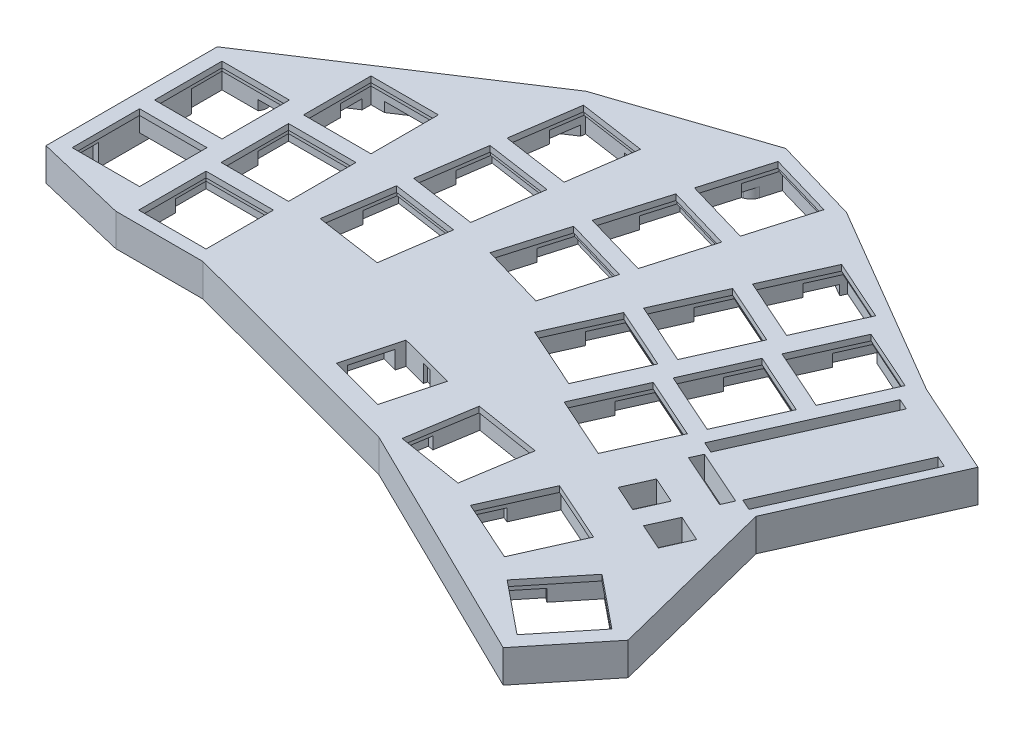
from build123d import *

# Parameters (mm, degrees)
LAYOUT_BASED_ON_OG_W   = 13.9
LAYOUT_BASED_ON_OG_H   = 13.9
TOP_PLATE_DEPTH        = 1.2
LAYOUT_BASED_ON_OG_7_R = 1
LAYOUT_BASED_ON_OG_7_W = 13.9
LAYOUT_BASED_ON_OG_7_H = 13.9
BOSS_EXTRUDE2_DEPTH    = 5.5
SKETCH1_W              = 14.7
SKETCH1_H              = 14.7
CUT_EXTRUDE1_DEPTH     = 5.5
CUT_EXTRUDE2_DEPTH     = 5.7
SKETCH5_W              = 17
SKETCH5_H              = 7.4
CUT_EXTRUDE3_DEPTH     = 4.5
CUT_EXTRUDE4_DEPTH     = 2.2
SKETCH8_R              = 2.5
SKETCH8_R_2            = 2.25
CUT_EXTRUDE5_DEPTH     = 2
FILLET1_R              = 0.75


with BuildPart() as part:
    # Layout Based on OG → Top Plate (new body)
    with BuildSketch(Plane(origin=(0, 0, 0), x_dir=(1, 0, 0), z_dir=(0, 1, 0))):
        Polygon((44.932112641, 64.586160661), (-1, 34.518088786), (-1, -0.789622065), (17.882445607, -5.291259199), (35.868672805, -5.291259199), (85.361540778, -18.518913408), (135.758281381, -43.294373445), (147.28611756, -29.083818781), (138.36478836, 6.221102631), (152.486966257, 37.866376671), (133.367786474, 46.398597243), (93.420652892, 69.813076074), (75.723768858, 74.969568789), align=None)
        with Locations((9, 8.5)):
            Rectangle(LAYOUT_BASED_ON_OG_W, LAYOUT_BASED_ON_OG_H, mode=Mode.SUBTRACT)
        with Locations((27, 4.208740801)):
            Rectangle(LAYOUT_BASED_ON_OG_W, LAYOUT_BASED_ON_OG_H, mode=Mode.SUBTRACT)
        Polygon((82.42671831, -1.483486994), (79.405763835, -12.786753516), (67.812669966, -9.68833867), (70.833624441, 1.614927852), align=None, mode=Mode.SUBTRACT)
        Polygon((124.073654328, -30.793104213), (132.830543438, -19.998341913), (143.625305738, -28.755231024), (134.868416628, -39.549993323), align=None, mode=Mode.SUBTRACT)
        Polygon((106.968309305, -21.25715678), (112.632924584, -8.563767408), (125.326313955, -14.228382687), (119.661698676, -26.921772059), align=None, mode=Mode.SUBTRACT)
        Polygon((87.98288219, -16.369909233), (90.169189468, -2.642926298), (103.896172402, -4.829233576), (101.709865125, -18.55621651), align=None, mode=Mode.SUBTRACT)
        Polygon((103.849381672, 19.547250989), (116.542771044, 13.88263571), (110.878155765, 1.189246339), (98.184766393, 6.853861618), align=None, mode=Mode.SUBTRACT)
        Polygon((124.470413663, -5.2830693), (118.991252783, -2.837911626), (121.436410458, 2.641249254), (126.915571338, 0.19609158), align=None, mode=Mode.SUBTRACT)
        Polygon((133.940230051, -9.509116814), (128.461069171, -7.06395914), (130.906226845, -1.58479826), (136.385387725, -4.029955934), align=None, mode=Mode.SUBTRACT)
        Polygon((132.512214648, 4.565915741), (120.951185191, 9.725198434), (121.970000889, 12.008182134), (133.531030346, 6.848899441), align=None, mode=Mode.SUBTRACT)
        with Locations((9, 25.5)):
            Rectangle(LAYOUT_BASED_ON_OG_W, LAYOUT_BASED_ON_OG_H, mode=Mode.SUBTRACT)
        with Locations((27, 21.208740801)):
            Rectangle(LAYOUT_BASED_ON_OG_W, LAYOUT_BASED_ON_OG_H, mode=Mode.SUBTRACT)
        with Locations((27, 38.208740801)):
            Rectangle(LAYOUT_BASED_ON_OG_W, LAYOUT_BASED_ON_OG_H, mode=Mode.SUBTRACT)
        Polygon((40.2890512, 14.443567583), (42.28500861, 28.199517351), (56.040958378, 26.20355994), (54.045000968, 12.447610172), align=None, mode=Mode.SUBTRACT)
        Polygon((63.880386081, 25.872461201), (67.768842672, 39.217494185), (81.113875656, 35.329037594), (77.225419065, 21.98400461), align=None, mode=Mode.SUBTRACT)
        Polygon((42.730150191, 31.26739104), (44.726107602, 45.023340808), (58.48205737, 43.027383397), (56.486099959, 29.271433629), align=None, mode=Mode.SUBTRACT)
        Polygon((45.171249182, 48.091214497), (47.167206593, 61.847164265), (60.923156361, 59.851206854), (58.92719895, 46.095257086), align=None, mode=Mode.SUBTRACT)
        Polygon((88.345576683, 28.974928579), (101.038966054, 23.310313301), (95.374350775, 10.616923929), (82.680961404, 16.281539208), align=None, mode=Mode.SUBTRACT)
        Polygon((95.273523427, 44.499217739), (107.966912798, 38.83460246), (102.302297519, 26.141213088), (89.608908148, 31.805828367), align=None, mode=Mode.SUBTRACT)
        Polygon((110.777328416, 35.071540149), (123.470717788, 29.40692487), (117.806102509, 16.713535498), (105.112713137, 22.378150777), align=None, mode=Mode.SUBTRACT)
        Polygon((122.242660591, 13.036314755), (119.959676891, 14.055130453), (132.389228402, 41.907531592), (134.672212102, 40.888715895), align=None, mode=Mode.SUBTRACT)
        Polygon((148.826711042, 34.572058569), (136.39715953, 6.71965743), (134.11417583, 7.738473128), (146.543727342, 35.590874267), align=None, mode=Mode.SUBTRACT)
        Polygon((112.040659882, 37.902439937), (117.70527516, 50.595829308), (130.398664532, 44.93121403), (124.734049253, 32.237824658), align=None, mode=Mode.SUBTRACT)
        Polygon((72.524509006, 55.538757546), (85.86954199, 51.650300955), (81.981085399, 38.305267971), (68.636052415, 42.193724562), align=None, mode=Mode.SUBTRACT)
        Polygon((96.536854892, 47.330117527), (102.201470171, 60.023506899), (114.894859542, 54.35889162), (109.230244263, 41.665502248), align=None, mode=Mode.SUBTRACT)
        Polygon((73.391718749, 58.514987924), (77.280175341, 71.860020908), (90.625208324, 67.971564317), (86.736751733, 54.626531333), align=None, mode=Mode.SUBTRACT)
    extrude(amount=TOP_PLATE_DEPTH)

    # Layout Based on OG<7> → Boss-Extrude2 (add)
    with BuildSketch(Plane(origin=(0, 0, 0), x_dir=(1, 0, 0), z_dir=(0, 1, 0))):
        Polygon((44.932112641, 64.586160661), (-1, 34.518088786), (-1, -0.789622065), (17.882445607, -5.291259199), (35.868672805, -5.291259199), (85.361540778, -18.518913408), (135.758281381, -43.294373445), (147.28611756, -29.083818781), (138.36478836, 6.221102631), (152.486966257, 37.866376671), (133.367786474, 46.398597243), (93.420652892, 69.813076074), (75.723768858, 74.969568789), align=None)
        with Locations((17.05, -2.008725367)):
            Circle(LAYOUT_BASED_ON_OG_7_R, mode=Mode.SUBTRACT)
        with Locations((9, 8.5)):
            Rectangle(LAYOUT_BASED_ON_OG_7_W, LAYOUT_BASED_ON_OG_7_H, mode=Mode.SUBTRACT)
        with Locations((27, 4.208740801)):
            Rectangle(LAYOUT_BASED_ON_OG_7_W, LAYOUT_BASED_ON_OG_7_H, mode=Mode.SUBTRACT)
        Polygon((82.42671831, -1.483486994), (79.405763835, -12.786753516), (67.812669966, -9.68833867), (70.833624441, 1.614927852), align=None, mode=Mode.SUBTRACT)
        with Locations((98.514300948, -21.642001273)):
            Circle(LAYOUT_BASED_ON_OG_7_R, mode=Mode.SUBTRACT)
        Polygon((124.073654328, -30.793104213), (132.830543438, -19.998341913), (143.625305738, -28.755231024), (134.868416628, -39.549993323), align=None, mode=Mode.SUBTRACT)
        Polygon((106.968309305, -21.25715678), (112.632924584, -8.563767408), (125.326313955, -14.228382687), (119.661698676, -26.921772059), align=None, mode=Mode.SUBTRACT)
        with Locations((143.005602273, -24.389532807)):
            Circle(LAYOUT_BASED_ON_OG_7_R, mode=Mode.SUBTRACT)
        Polygon((87.98288219, -16.369909233), (90.169189468, -2.642926298), (103.896172402, -4.829233576), (101.709865125, -18.55621651), align=None, mode=Mode.SUBTRACT)
        Polygon((103.849381672, 19.547250989), (116.542771044, 13.88263571), (110.878155765, 1.189246339), (98.184766393, 6.853861618), align=None, mode=Mode.SUBTRACT)
        Polygon((124.470413663, -5.2830693), (118.991252783, -2.837911626), (121.436410458, 2.641249254), (126.915571338, 0.19609158), align=None, mode=Mode.SUBTRACT)
        Polygon((133.940230051, -9.509116814), (128.461069171, -7.06395914), (130.906226845, -1.58479826), (136.385387725, -4.029955934), align=None, mode=Mode.SUBTRACT)
        Polygon((132.512214648, 4.565915741), (120.951185191, 9.725198434), (121.970000889, 12.008182134), (133.531030346, 6.848899441), align=None, mode=Mode.SUBTRACT)
        with Locations((9, 25.5)):
            Rectangle(LAYOUT_BASED_ON_OG_7_W, LAYOUT_BASED_ON_OG_7_H, mode=Mode.SUBTRACT)
        with Locations((27, 21.208740801)):
            Rectangle(LAYOUT_BASED_ON_OG_7_W, LAYOUT_BASED_ON_OG_7_H, mode=Mode.SUBTRACT)
        with Locations((5.901015243, 35.45)):
            Circle(LAYOUT_BASED_ON_OG_7_R, mode=Mode.SUBTRACT)
        with Locations((27, 38.208740801)):
            Rectangle(LAYOUT_BASED_ON_OG_7_W, LAYOUT_BASED_ON_OG_7_H, mode=Mode.SUBTRACT)
        Polygon((40.2890512, 14.443567583), (42.28500861, 28.199517351), (56.040958378, 26.20355994), (54.045000968, 12.447610172), align=None, mode=Mode.SUBTRACT)
        Polygon((63.880386081, 25.872461201), (67.768842672, 39.217494185), (81.113875656, 35.329037594), (77.225419065, 21.98400461), align=None, mode=Mode.SUBTRACT)
        Polygon((42.730150191, 31.26739104), (44.726107602, 45.023340808), (58.48205737, 43.027383397), (56.486099959, 29.271433629), align=None, mode=Mode.SUBTRACT)
        Polygon((45.171249182, 48.091214497), (47.167206593, 61.847164265), (60.923156361, 59.851206854), (58.92719895, 46.095257086), align=None, mode=Mode.SUBTRACT)
        with Locations((72.753454085, 70.801954714)):
            Circle(LAYOUT_BASED_ON_OG_7_R, mode=Mode.SUBTRACT)
        Polygon((88.345576683, 28.974928579), (101.038966054, 23.310313301), (95.374350775, 10.616923929), (82.680961404, 16.281539208), align=None, mode=Mode.SUBTRACT)
        Polygon((95.273523427, 44.499217739), (107.966912798, 38.83460246), (102.302297519, 26.141213088), (89.608908148, 31.805828367), align=None, mode=Mode.SUBTRACT)
        Polygon((110.777328416, 35.071540149), (123.470717788, 29.40692487), (117.806102509, 16.713535498), (105.112713137, 22.378150777), align=None, mode=Mode.SUBTRACT)
        Polygon((122.242660591, 13.036314755), (119.959676891, 14.055130453), (132.389228402, 41.907531592), (134.672212102, 40.888715895), align=None, mode=Mode.SUBTRACT)
        Polygon((148.826711042, 34.572058569), (136.39715953, 6.71965743), (134.11417583, 7.738473128), (146.543727342, 35.590874267), align=None, mode=Mode.SUBTRACT)
        Polygon((112.040659882, 37.902439937), (117.70527516, 50.595829308), (130.398664532, 44.93121403), (124.734049253, 32.237824658), align=None, mode=Mode.SUBTRACT)
        with Locations((145.3286298, 37.775717045)):
            Circle(LAYOUT_BASED_ON_OG_7_R, mode=Mode.SUBTRACT)
        Polygon((72.524509006, 55.538757546), (85.86954199, 51.650300955), (81.981085399, 38.305267971), (68.636052415, 42.193724562), align=None, mode=Mode.SUBTRACT)
        Polygon((96.536854892, 47.330117527), (102.201470171, 60.023506899), (114.894859542, 54.35889162), (109.230244263, 41.665502248), align=None, mode=Mode.SUBTRACT)
        Polygon((73.391718749, 58.514987924), (77.280175341, 71.860020908), (90.625208324, 67.971564317), (86.736751733, 54.626531333), align=None, mode=Mode.SUBTRACT)
    extrude(amount=-BOSS_EXTRUDE2_DEPTH)

    # Sketch1 → Cut-Extrude1 (cut)
    with BuildSketch(Plane.XZ):
        Polygon((124.936316134, -31.709536754), (130.926952436, -45.13348091), (117.50300828, -51.124117212), (111.512371978, -37.700173056), align=None)
        Polygon((118.00836939, -16.185247595), (123.999005692, -29.60919175), (110.575061536, -35.599828052), (104.584425234, -22.175883897), align=None)
        Polygon((111.080422646, -0.660958435), (117.071058948, -14.084902591), (103.647114792, -20.075538893), (97.65647849, -6.651594737), align=None)
        Polygon((95.576617656, -10.088636025), (101.567253958, -23.512580181), (88.143309802, -29.503216483), (82.1526735, -16.079272327), align=None)
        Polygon((102.5045644, -25.612925185), (108.495200702, -39.036869341), (95.071256546, -45.027505643), (89.080620244, -31.603561487), align=None)
        Polygon((109.432511144, -41.137214344), (115.423147446, -54.5611585), (101.99920329, -60.551794802), (96.008566988, -47.127850647), align=None)
        Polygon((119.863965557, 27.450059962), (125.854601859, 14.026115807), (112.430657703, 8.035479505), (106.440021401, 21.45942366), align=None)
        Polygon((144.187943189, 28.696587191), (134.927060461, 40.112630774), (123.511016877, 30.851748046), (132.771899605, 19.435704463), align=None)
        Polygon((104.354108811, 4.497127801), (102.041970899, 19.014152919), (87.524945781, 16.702015007), (89.837083693, 2.184989889), align=None)
        Polygon((86.365469748, -51.92243265), (82.253217094, -37.809340214), (68.140124658, -41.921592868), (72.252377311, -56.034685304), align=None)
        Polygon((91.121136082, -68.243696011), (87.008883428, -54.130603575), (72.895790992, -58.242856229), (77.008043646, -72.355948665), align=None)
        Polygon((61.376448654, -60.189623901), (59.265615997, -45.641964794), (44.71795689, -47.752797451), (46.828789547, -62.300456558), align=None)
        with Locations((27, -38.208740801)):
            Rectangle(SKETCH1_W, SKETCH1_H)
        Polygon((81.609803413, -35.601169288), (77.497550759, -21.488076852), (63.384458323, -25.600329506), (67.496710977, -39.713421942), align=None)
        Polygon((58.935349662, -43.365800443), (56.824517005, -28.818141336), (42.276857898, -30.928973994), (44.387690555, -45.476633101), align=None)
        Polygon((56.494250671, -26.541976986), (54.383418014, -11.994317879), (39.835758907, -14.105150536), (41.946591564, -28.652809644), align=None)
        with Locations((27, -21.208740801)):
            Rectangle(SKETCH1_W, SKETCH1_H)
        with Locations((27, -4.208740801)):
            Rectangle(SKETCH1_W, SKETCH1_H)
        with Locations((9, -8.5)):
            Rectangle(SKETCH1_W, SKETCH1_H)
        with Locations((9, -25.5)):
            Rectangle(SKETCH1_W, SKETCH1_H)
    extrude(amount=CUT_EXTRUDE1_DEPTH, mode=Mode.SUBTRACT)

    # Sketch4 → Cut-Extrude2 (cut)
    with BuildSketch(Plane.XZ.offset(5.5)):
        Polygon((75.052980345, 9.708478692), (74.381657128, 12.220315697), (72.449474817, 11.703913223), (73.120798034, 9.192076218), align=None)
        Polygon((83.02323238, 11.838638899), (75.052980345, 9.708478692), (77.118590243, 1.979749446), (85.088842277, 4.109909653), align=None)
        Polygon((77.789913459, -0.532087558), (77.118590243, 1.979749446), (75.186407931, 1.463346972), (75.857731148, -1.048490033), align=None)
        Polygon((75.186407931, 1.463346972), (73.120798034, 9.192076218), (65.150545999, 7.061916011), (67.216155897, -0.666813235), align=None)
    extrude(amount=-CUT_EXTRUDE2_DEPTH, mode=Mode.SUBTRACT)

    # Sketch5 → Cut-Extrude3 (cut)
    with BuildSketch(Plane.XZ.offset(5.5)):
        Polygon((90.476814804, -61.9215247), (92.546928385, -69.026074634), (76.225665023, -73.781740968), (74.155551443, -66.677191034), align=None)
        Polygon((80.965482135, -29.278997977), (83.035595716, -36.383547911), (66.714332355, -41.139214245), (64.644218774, -34.034664311), align=None)
        Polygon((85.72114847, -45.600261338), (87.79126205, -52.704811272), (71.469998689, -57.460477607), (69.399885108, -50.355927673), align=None)
        Polygon((113.926280704, -48.385044029), (116.941975169, -55.142675781), (101.417686009, -62.070622525), (98.401991544, -55.312990773), align=None)
        Polygon((106.99833396, -32.86075487), (110.014028425, -39.618386622), (94.489739265, -46.546333366), (91.4740448, -39.788701614), align=None)
        Polygon((100.070387216, -17.33646571), (103.086081681, -24.094097462), (87.561792521, -31.022044206), (84.546098056, -24.264412454), align=None)
        Polygon((115.574192206, -7.90878812), (118.589886671, -14.666419872), (103.065597511, -21.594366616), (100.049903046, -14.836734864), align=None)
        Polygon((122.50213895, -23.433077279), (125.517833415, -30.190709031), (109.993544255, -37.118655775), (106.97784979, -30.361024024), align=None)
        Polygon((129.430085694, -38.957366439), (132.445780159, -45.714998191), (116.921490999, -52.642944935), (113.905796534, -45.885313183), align=None)
        Polygon((61.617067964, -53.839261521), (62.679663996, -61.162572909), (45.855840539, -63.6036719), (44.793244507, -56.280360513), align=None)
        Polygon((59.175968973, -37.015438064), (60.238565005, -44.338749451), (43.414741547, -46.779848443), (42.352145516, -39.456537055), align=None)
        Polygon((56.734869982, -20.191614607), (57.797466013, -27.514925994), (40.973642556, -29.956024986), (39.911046525, -22.632713598), align=None)
        with Locations((27, -43.008740801)):
            Rectangle(SKETCH5_W, SKETCH5_H)
        with Locations((27, -26.008740801)):
            Rectangle(SKETCH5_W, SKETCH5_H)
        with Locations((9, -30.3)):
            Rectangle(SKETCH5_W, SKETCH5_H)
        with Locations((9, -3.7)):
            Rectangle(SKETCH5_W, SKETCH5_H)
        with Locations((27, -9.008740801)):
            Rectangle(SKETCH5_W, SKETCH5_H)
        Polygon((120.445482838, 28.968887685), (123.461177303, 22.211255933), (107.936888143, 15.283309189), (104.921193678, 22.040940941), align=None)
        Polygon((102.996775, 20.330720095), (104.160708371, 13.0228299), (87.372311976, 10.348928913), (86.208378605, 17.656819108), align=None)
        Polygon((135.09566148, 41.730213445), (139.757602445, 35.983361573), (126.555375172, 25.273497193), (121.893434207, 31.020349065), align=None)
    extrude(amount=-CUT_EXTRUDE3_DEPTH, mode=Mode.SUBTRACT)

    # Sketch6 → Cut-Extrude4 (cut)
    with BuildSketch(Plane.XZ.offset(5.5)):
        Polygon((137.298581205, 4.437482213), (129.993033365, 1.177271981), (127.547875691, 6.656432861), (134.853423531, 9.916643093), align=None)
        Polygon((125.383607143, 5.690595579), (127.828764818, 0.211434699), (120.523216978, -3.048775533), (118.078059304, 2.430385347), align=None)
    extrude(amount=-CUT_EXTRUDE4_DEPTH, mode=Mode.SUBTRACT)

    # Sketch8 → Cut-Extrude5 (cut)
    with BuildSketch(Plane.XZ.offset(5.5)):
        with BuildLine():
            Line((139.204412223, 23.173053982), (142.654833761, 18.919662182))
            Line((142.654833761, 18.919662182), (136.255917661, -6.403159671))
            Line((136.255917661, -6.403159671), (148.826711042, -34.572058569))
            Line((148.826711042, -34.572058569), (146.543727342, -35.590874267))
            ThreePointArc((146.543727342, -35.590874267), (144.309814103, -35.492733345), (142.890953422, -37.220979383))
            Line((142.890953422, -37.220979383), (131.019438182, -42.518821011))
            Line((131.019438182, -42.518821011), (116.921490999, -52.642944935))
            Line((116.921490999, -52.642944935), (116.434522933, -54.005566109))
            Line((116.434522933, -54.005566109), (100.910233773, -60.933512853))
            Line((100.910233773, -60.933512853), (91.752890515, -66.300967302))
            Line((91.752890515, -66.300967302), (75.431627153, -71.056633637))
            Line((75.431627153, -71.056633637), (75.153639873, -70.102592018))
            ThreePointArc((75.153639873, -70.102592018), (74.557701937, -69.071437541), (73.552294547, -68.433019528))
            Line((73.552294547, -68.433019528), (55.20726644, -62.246801008))
            Line((55.20726644, -62.246801008), (45.727060034, -62.716128839))
            Line((45.727060034, -62.716128839), (21.274106965, -46.708740801))
            Line((21.274106965, -46.708740801), (18.5, -44.892755365))
            Line((18.5, -44.892755365), (7.270371182, -37.541617631))
            ThreePointArc((7.270371182, -37.541617631), (8.357801287, -35.91281998), (7.937556428, -34))
            Line((7.937556428, -34), (1.65, -34))
            Line((1.65, -34), (1.65, -32.85))
            Line((1.65, -32.85), (1.65, -0.634659927))
            Line((1.65, -0.634659927), (19.65, -0.634659927))
            Line((19.65, -0.634659927), (34.35, 3.141259199))
            Line((34.35, 3.141259199), (35.570084054, 3.141259199))
            Line((35.570084054, 3.141259199), (86.358362209, 16.715129715))
            Line((86.358362209, 16.715129715), (100.310206629, 19.902828255))
            ThreePointArc((100.310206629, 19.902828255), (101.01123396, 21.76579762), (100.129367893, 23.55028814))
            Line((100.129367893, 23.55028814), (131.997484899, 39.216921535))
            Line((131.997484899, 39.216921535), (138.479921397, 24.066145827))
            Line((138.479921397, 24.066145827), (139.204412223, 23.173053982))
        make_face()
        with Locations((136.661892762, -29.397342614)):
            Circle(SKETCH8_R, mode=Mode.SUBTRACT)
        with Locations((131.696592578, -18.270993254)):
            Circle(SKETCH8_R, mode=Mode.SUBTRACT)
        with Locations((109.591444293, 3.388071472)):
            Circle(SKETCH8_R_2, mode=Mode.SUBTRACT)
        with BuildLine():
            Line((130.503779674, 9.848098828), (124.686737206, 7.25215643))
            ThreePointArc((124.686737206, 7.25215643), (122.045297688, 8.263490832), (123.05663209, 10.90493035))
            Line((123.05663209, 10.90493035), (128.873674557, 13.500872748))
            ThreePointArc((128.873674557, 13.500872748), (131.515114075, 12.489538346), (130.503779674, 9.848098828))
        make_face(mode=Mode.SUBTRACT)
        with BuildLine():
            Line((92.662522229, -57.762593938), (90.153625751, -50.925034445))
            ThreePointArc((90.153625751, -50.925034445), (91.045113783, -49.000132087), (92.970016141, -49.89162012))
            Line((92.970016141, -49.89162012), (95.478912619, -56.729179612))
            ThreePointArc((95.478912619, -56.729179612), (94.587424587, -58.65408197), (92.662522229, -57.762593938))
        make_face(mode=Mode.SUBTRACT)
        with BuildLine():
            Line((86.001869892, -39.610148428), (84.283987118, -34.928358736))
            ThreePointArc((84.283987118, -34.928358736), (85.175475151, -33.003456378), (87.100377509, -33.89494441))
            Line((87.100377509, -33.89494441), (88.818260283, -38.576734102))
            ThreePointArc((88.818260283, -38.576734102), (87.92677225, -40.50163646), (86.001869892, -39.610148428))
        make_face(mode=Mode.SUBTRACT)
        with BuildLine():
            Line((86.814692561, -7.850021098), (63.028921107, -14.20709784))
            ThreePointArc((63.028921107, -14.20709784), (59.968190125, -12.437373044), (61.737914921, -9.376642062))
            Line((61.737914921, -9.376642062), (85.523686375, -3.01956532))
            ThreePointArc((85.523686375, -3.01956532), (88.584417357, -4.789290116), (86.814692561, -7.850021098))
        make_face(mode=Mode.SUBTRACT)
        with BuildLine():
            Line((64.970718214, -56.485039592), (62.537305637, -45.272693234))
            ThreePointArc((62.537305637, -45.272693234), (63.685041764, -43.488680403), (65.469054595, -44.63641653))
            Line((65.469054595, -44.63641653), (67.902467172, -55.848762888))
            ThreePointArc((67.902467172, -55.848762888), (66.754731045, -57.632775719), (64.970718214, -56.485039592))
        make_face(mode=Mode.SUBTRACT)
        with BuildLine():
            Line((38.423692073, -53.453161546), (37.944396883, -46.816793128))
            ThreePointArc((37.944396883, -46.816793128), (39.332447725, -45.212637631), (40.936603222, -46.600688473))
            Line((40.936603222, -46.600688473), (41.415898413, -53.237056891))
            ThreePointArc((41.415898413, -53.237056891), (40.027847571, -54.841212388), (38.423692073, -53.453161546))
        make_face(mode=Mode.SUBTRACT)
        with BuildLine():
            Line((58.13403364, -1.541487636), (45.001022976, -5.051466566))
            ThreePointArc((45.001022976, -5.051466566), (41.940291994, -3.28174177), (43.71001679, -0.221010787))
            Line((43.71001679, -0.221010787), (56.843027454, 3.288968143))
            ThreePointArc((56.843027454, 3.288968143), (59.903758436, 1.519243347), (58.13403364, -1.541487636))
        make_face(mode=Mode.SUBTRACT)
    extrude(amount=-CUT_EXTRUDE5_DEPTH, mode=Mode.SUBTRACT)

    # Fillet1
    fillet1_edges = [part.edges().sort_by_distance(p)[0] for p in [
        (41.940291994, -3.5, -3.28174177),
        (51.567528308, -3.5, -3.296477101),
        (50.276522122, -3.5, 1.533978678),
        (59.903758436, -3.5, 1.519243347),
        (38.184044478, -3.5, -50.134977337),
        (40.027847571, -3.5, -54.841212388),
        (41.176250818, -3.5, -49.918872682),
        (39.332447725, -3.5, -45.212637631),
        (63.685041764, -3.5, -43.488680403),
        (66.685760884, -3.5, -50.242589709),
        (63.754011925, -3.5, -50.878866413),
        (66.754731045, -3.5, -57.632775719),
        (94.587424587, -3.5, -58.65408197),
        (91.40807399, -3.5, -54.343814191),
        (91.045113783, -3.5, -49.000132087),
        (94.22446438, -3.5, -53.310399866),
        (87.959318896, -3.5, -36.235839256),
        (87.92677225, -3.5, -40.50163646),
        (85.142928505, -3.5, -37.269253582),
        (85.175475151, -3.5, -33.003456378),
        (74.921806834, -3.5, -11.028559469),
        (88.584417357, -3.5, -4.789290116),
        (59.968190125, -3.5, -12.437373044),
        (73.630800648, -3.5, -6.198103691),
        (127.59525844, -3.5, 8.550127629),
        (131.515114075, -3.5, 12.489538346),
        (125.965153324, -3.5, 12.202901549),
        (122.045297688, -3.5, 8.263490832),
        (107.341444293, -3.5, 3.388071472),
        (134.161892762, -3.5, -29.397342614),
        (129.196592578, -3.5, -18.270993254),
    ]]
    fillet(fillet1_edges, radius=FILLET1_R)


solid = part.part
